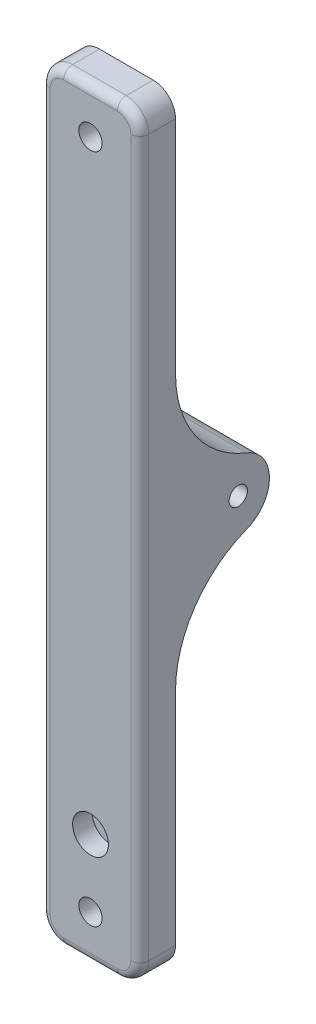
from build123d import *

# Parameters (mm, degrees)
SKETCH1_W                                           = 22
SKETCH1_H                                           = 170
BOSS_EXTRUDE1_DEPTH                                 = 14.5
SKETCH2_W                                           = 21
SKETCH2_H                                           = 79
CUT_EXTRUDE1_DEPTH                                  = 89.990167996
FILLET3_R                                           = 25
FILLET1_R                                           = 5
FILLET2_R                                           = 2
FILLET4_R                                           = 8
TAPPED_HOLE_FOR_M5X0_8_HELICOIL1_D                  = 5.2
CBORE_FOR_M4_HEX_SOCKET_HEAD_CAP_SCREW1_D           = 4.5
CBORE_FOR_M4_HEX_SOCKET_HEAD_CAP_SCREW1_CBORE_D     = 8
CBORE_FOR_M4_HEX_SOCKET_HEAD_CAP_SCREW1_CBORE_DEPTH = 4.4
SKETCH9_R                                           = 2.05
CUT_EXTRUDE2_DEPTH                                  = 89.990167996


with BuildPart() as part:
    # Sketch1 → Boss-Extrude1 (new, symmetric)
    with BuildSketch(Plane.XY):
        Rectangle(SKETCH1_W, SKETCH1_H)
    extrude(amount=BOSS_EXTRUDE1_DEPTH, both=True)

    # Sketch2 → Cut-Extrude1 (cut, through all)
    with BuildSketch(Plane(origin=(11, 0, 0), x_dir=(0, 0, -1), z_dir=(1, 0, 0))):
        with Locations((4, 45.5)):
            Rectangle(SKETCH2_W, SKETCH2_H)
    cut_extrude1 = extrude(amount=-CUT_EXTRUDE1_DEPTH, mode=Mode.SUBTRACT)

    # Mirror1: Cut-Extrude1 across plane
    add(cut_extrude1.mirror(Plane.ZX), mode=Mode.SUBTRACT)

    # Fillet3
    # the kernel refuses this fillet: 25 mm, written as the material it adds along each edge
    with BuildSketch(Plane(origin=(11, 6, 6.5), x_dir=(0, 0, -1), z_dir=(-1, 0, 0))) as fillet3_piece_1:
        with BuildLine():
            CenterArc((25, -24.677925359), FILLET3_R, 99.206896221, 80.793103779)
            Line((0, -24.677925359), (-0.5, -24.677925359))
            Line((-0.5, -24.677925359), (-0.5, 0))
            Line((-0.5, 0), (0, 0.5))
            ThreePointArc((0, 0.5), (10.5, 0.5), (20.92, 0.493558507))
            Line((20.92, 0.493558507), (21, 0))
        make_face()
    extrude(amount=22)
    with BuildSketch(Plane(origin=(11, -6, 6.5), x_dir=(0, -1, 0), z_dir=(-1, 0, 0))) as fillet3_piece_2:
        with BuildLine():
            CenterArc((24.677925359, -25), FILLET3_R, 90, 80.793103779)
            Line((0, -21), (-0.493558507, -20.92))
            ThreePointArc((-0.493558507, -20.92), (-0.5, -10.5), (-0.5, 0))
            Line((-0.5, 0), (0, 0.5))
            Line((0, 0.5), (24.677925359, 0.5))
            Line((24.677925359, 0.5), (24.677925359, 0))
        make_face()
    extrude(amount=22)

    # Fillet1
    fillet1_edges = [part.edges().sort_by_distance(p)[0] for p in [
        (11, -85, 10.5),
        (-11, -85, 10.5),
        (-11, 85, 10.5),
        (11, 85, 10.5),
    ]]
    fillet(fillet1_edges, radius=FILLET1_R)

    # Fillet2
    fillet2_edges = [part.edges().sort_by_distance(p)[0] for p in [
        (11, 0, 14.5),
        (0, -85, 14.5),
        (0, 85, 14.5),
        (-11, 0, 14.5),
        (9.535533906, 83.535533906, 14.5),
        (-9.535533906, 83.535533906, 14.5),
        (-9.535533906, -83.535533906, 14.5),
        (9.535533906, -83.535533906, 14.5),
    ]]
    fillet(fillet2_edges, radius=FILLET2_R)

    # Fillet4
    # the kernel refuses this fillet: 8 mm, written as the material it takes off along each edge
    with BuildSketch(Plane(origin=(26.157317348, -6, -14.5), x_dir=(0, 1, 0), z_dir=(-1, 0, 0))) as fillet4_piece_1:
        with BuildLine():
            CenterArc((6.062926939, -8), FILLET4_R, 90, 68.676313737)
            ThreePointArc((-1.38940089, -5.090909091), (-0.559998083, -2.582217249), (0, 0))
            Line((0, 0), (6.062926939, 0))
        make_face()
    extrude(amount=52.314634697, mode=Mode.SUBTRACT)
    with BuildSketch(Plane(origin=(26.157317348, 6, -14.5), x_dir=(0, 0.2632886899666048, 0.96471709103533), z_dir=(-1, 0, 0))) as fillet4_piece_2:
        with BuildLine():
            CenterArc((6.121436637, -7.95531876), FILLET4_R, 96.058395021, 68.676313736)
            Line((-1.596300091, -5.84900924), (0, 0))
            ThreePointArc((0, 0), (2.638550275, -0.139628875), (5.277100549, 0))
        make_face()
    extrude(amount=52.314634697, mode=Mode.SUBTRACT)

    # Tapped Hole for M5x0.8 Helicoil1 (through all)
    with Locations(Plane.XY.offset(14.5)):
        with Locations((0, 75)):
            tapped_hole_for_m5x0_8_helicoil1 = Hole(TAPPED_HOLE_FOR_M5X0_8_HELICOIL1_D / 2)

    # Mirror2: Tapped Hole for M5x0.8 Helicoil1 across plane
    add(tapped_hole_for_m5x0_8_helicoil1.mirror(Plane.ZX), mode=Mode.SUBTRACT)

    # CBORE for M4 Hex Socket Head Cap Screw1 (through all)
    with Locations(Plane.XY.offset(14.5)):
        with Locations((0, -60.0028)):
            CounterBoreHole(CBORE_FOR_M4_HEX_SOCKET_HEAD_CAP_SCREW1_D / 2, CBORE_FOR_M4_HEX_SOCKET_HEAD_CAP_SCREW1_CBORE_D / 2, CBORE_FOR_M4_HEX_SOCKET_HEAD_CAP_SCREW1_CBORE_DEPTH)

    # Sketch9 → Cut-Extrude2 (cut, through all)
    with BuildSketch(Plane(origin=(11, 0, 0), x_dir=(0, 0, -1), z_dir=(1, 0, 0))):
        with Locations((7.517, 0)):
            Circle(SKETCH9_R)
    extrude(amount=-CUT_EXTRUDE2_DEPTH, mode=Mode.SUBTRACT)


solid = part.part
